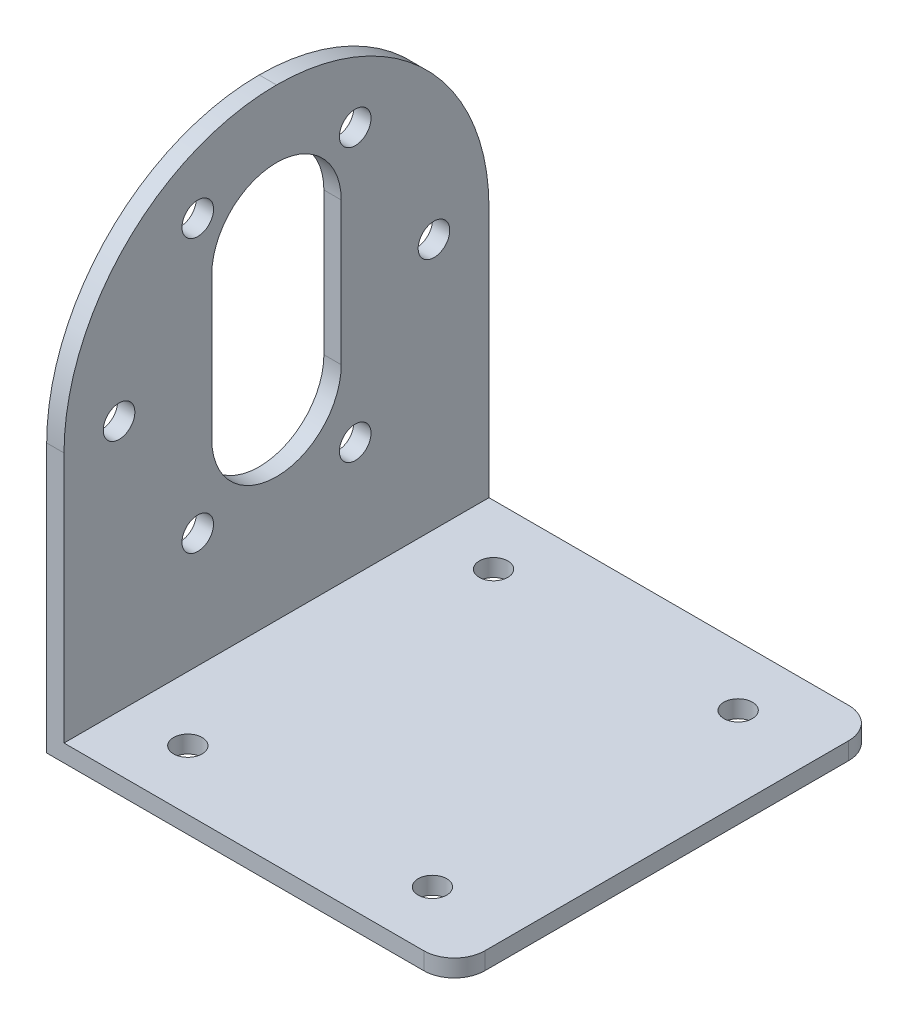
from build123d import *

# Parameters (mm, degrees)
CROQUIS1_R              = 1.4
SALIENTE_EXTRUIR1_DEPTH = 1.7
CROQUIS2_W              = 1.7
CROQUIS2_H              = 41.7
SALIENTE_EXTRUIR2_DEPTH = 45.5
REDONDEO1_R             = 20.85
CROQUIS3_R              = 1.55
CORTAR_EXTRUIR1_DEPTH   = 65.26081621


with BuildPart() as part:
    # Croquis1 → Saliente-Extruir1 (new body)
    with BuildSketch(Plane(origin=(0, 0, 0), x_dir=(1, 0, 0), z_dir=(0, 1, 0))):
        with BuildLine():
            Line((-20, -20.85), (17, -20.85))
            ThreePointArc((17, -20.85), (19.121320344, -19.971320344), (20, -17.85))
            Line((20, -17.85), (20, 17.85))
            ThreePointArc((20, 17.85), (19.121320344, 19.971320344), (17, 20.85))
            Line((17, 20.85), (-20, 20.85))
            Line((-20, 20.85), (-20, -20.85))
        make_face()
        with Locations(Location((-12, 15, 0), (0, 0, 270))):
            Circle(CROQUIS1_R, mode=Mode.SUBTRACT)
        with Locations(Location((12, 15, 0), (0, 0, 270))):
            Circle(CROQUIS1_R, mode=Mode.SUBTRACT)
        with Locations(Location((12, -15, 0), (0, 0, 270))):
            Circle(CROQUIS1_R, mode=Mode.SUBTRACT)
        with Locations(Location((-12, -15, 0), (0, 0, 270))):
            Circle(CROQUIS1_R, mode=Mode.SUBTRACT)
    extrude(amount=SALIENTE_EXTRUIR1_DEPTH)

    # Croquis2 → Saliente-Extruir2 (add)
    with BuildSketch(Plane(origin=(0, 1.7, 0), x_dir=(1, 0, 0), z_dir=(0, 1, 0))):
        with Locations((-19.15, 0)):
            Rectangle(CROQUIS2_W, CROQUIS2_H)
    extrude(amount=SALIENTE_EXTRUIR2_DEPTH)

    # Redondeo1
    redondeo1_edges = [part.edges().sort_by_distance(p)[0] for p in [
        (-19.15, 47.2, -20.85),
        (-19.15, 47.2, 20.85),
    ]]
    fillet(redondeo1_edges, radius=REDONDEO1_R - 0.0001)  # a hair under: the kernel refuses the full size

    # Croquis3 → Cortar-Extruir1 (cut, through all)
    with BuildSketch(Plane(origin=(-18.3, 0, 0), x_dir=(0, 0, -1), z_dir=(1, 0, 0))):
        with Locations((15.45, 26.35)):
            Circle(CROQUIS3_R)
        with Locations((7.725, 12.969907512)):
            Circle(CROQUIS3_R)
        with Locations((-7.725, 12.969907512)):
            Circle(CROQUIS3_R)
        with Locations((-15.45, 26.35)):
            Circle(CROQUIS3_R)
        with Locations((-7.725, 39.730092488)):
            Circle(CROQUIS3_R)
        with Locations((7.725, 39.730092488)):
            Circle(CROQUIS3_R)
        with BuildLine():
            Line((6.35, 34.25), (6.35, 20.25))
            ThreePointArc((6.35, 20.25), (0, 13.9), (-6.35, 20.25))
            Line((-6.35, 20.25), (-6.35, 34.25))
            ThreePointArc((-6.35, 34.25), (0, 40.6), (6.35, 34.25))
        make_face()
    extrude(amount=-CORTAR_EXTRUIR1_DEPTH, mode=Mode.SUBTRACT)


solid = part.part
